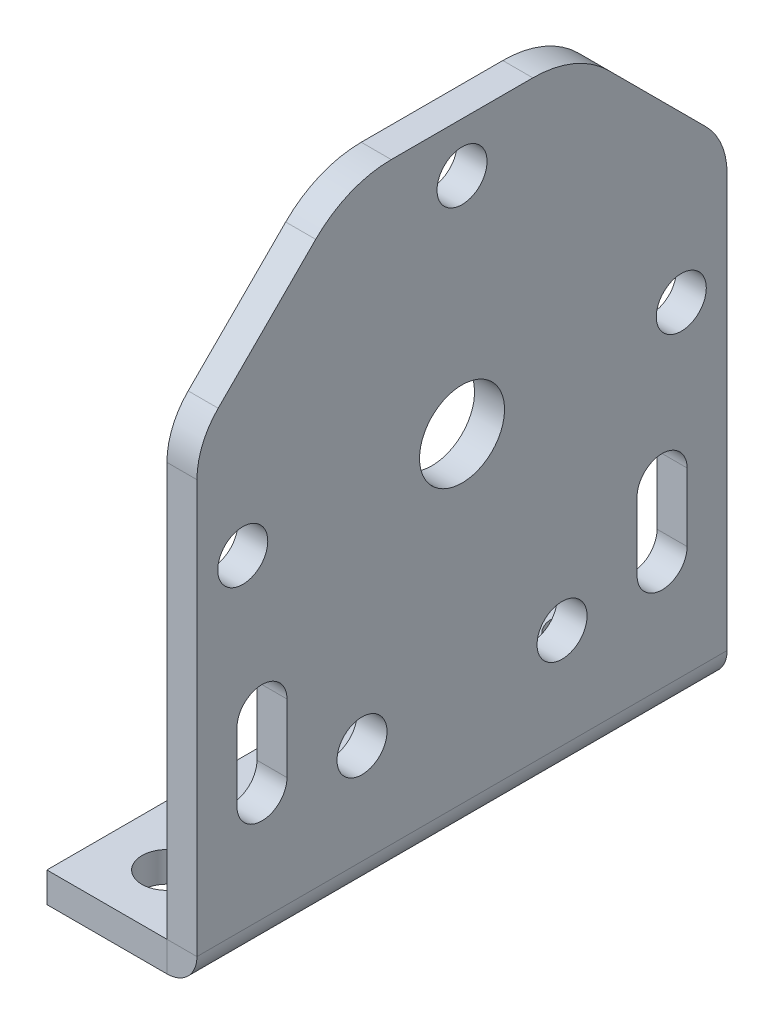
from build123d import *

# Parameters (mm, degrees)
SM_BASE_FLANGE_1_DEPTH = 53
HOLE_WIZARD_M6_1_D     = 5
HOLE_WIZARD_M6_1_DEPTH = 3
HOLE_WIZARD_M6_1_TIP   = 1.502151548
HOLE_WIZARD_M6_2_D     = 5
HOLE_WIZARD_M6_2_DEPTH = 17
HOLE_WIZARD_M6_2_TIP   = 1.502151548
SKETCH_16_R            = 4.25
CUT_EXTRUDE_1_DEPTH    = 3
CHAMFER_1_SIZE         = 15
FILLET_1_R             = 10.68
FILLET_2_R             = 7.25


# Read off the part's stored shape, not the designer's step: 基体-法兰1
with BuildPart() as part:
    # 基体-法兰1 outline → 基体-法兰1 (new body)
    with BuildSketch(Plane.XY):
        with BuildLine():
            Line((15, 0), (15, 59.29))
            Line((15, 59.29), (12, 59.29))
            Line((12, 59.29), (12, 0))
            Line((12, 0), (0, 0))
            Line((0, 0), (0, -3))
            Line((0, -3), (12, -3))
            ThreePointArc((12, -3), (14.121320344, -2.121320344), (15, 0))
        make_face()
    extrude(amount=SM_BASE_FLANGE_1_DEPTH)

    # M6 螺纹孔1
    with Locations(Plane(origin=(15, 0, 0), x_dir=(0, 0, -1), z_dir=(1, 0, 0))):
        with Locations((-26.5, 54.35), (-48.42, 32.43), (-4.58, 32.43), (-36.5, 10), (-16.5, 10)):
            Hole(HOLE_WIZARD_M6_1_D / 2, depth=HOLE_WIZARD_M6_1_DEPTH)
            with Locations((0, 0, -(HOLE_WIZARD_M6_1_DEPTH + HOLE_WIZARD_M6_1_TIP / 2))):  # 118° drill point
                Cone(0, HOLE_WIZARD_M6_1_D / 2, HOLE_WIZARD_M6_1_TIP, mode=Mode.SUBTRACT)

    # M6 螺纹孔2
    with Locations(Plane(origin=(0, 0, 0), x_dir=(1, 0, 0), z_dir=(0, 1, 0))):
        with Locations((6, -6), (6, -47)):
            Hole(HOLE_WIZARD_M6_2_D / 2, depth=HOLE_WIZARD_M6_2_DEPTH)
            with Locations((0, 0, -(HOLE_WIZARD_M6_2_DEPTH + HOLE_WIZARD_M6_2_TIP / 2))):  # 118° drill point
                Cone(0, HOLE_WIZARD_M6_2_D / 2, HOLE_WIZARD_M6_2_TIP, mode=Mode.SUBTRACT)

    # 草图16 → 切除-拉伸1 (cut)
    with BuildSketch(Plane.ZY.offset(-12)):
        with Locations((26.5, 32)):
            Circle(SKETCH_16_R)
        with BuildLine():
            Line((44, 17.8), (44, 11))
            ThreePointArc((44, 11), (46.5, 8.5), (49, 11))
            Line((49, 11), (49, 17.8))
            ThreePointArc((49, 17.8), (46.5, 20.3), (44, 17.8))
        make_face()
        with BuildLine():
            Line((9, 17.8), (9, 11))
            ThreePointArc((9, 11), (6.5, 8.5), (4, 11))
            Line((4, 11), (4, 17.8))
            ThreePointArc((4, 17.8), (6.5, 20.3), (9, 17.8))
        make_face()
    extrude(amount=-CUT_EXTRUDE_1_DEPTH, mode=Mode.SUBTRACT)

    # 倒角1
    chamfer_1_edges = [part.edges().sort_by_distance(p)[0] for p in [
        (13.5, 59.29, 0),
        (13.5, 59.29, 53),
    ]]
    chamfer(chamfer_1_edges, length=CHAMFER_1_SIZE)

    # 圆角1
    fillet_1_edges = [part.edges().sort_by_distance(p)[0] for p in [
        (13.5, 59.29, 15),
        (13.5, 59.29, 38),
    ]]
    fillet(fillet_1_edges, radius=FILLET_1_R)

    # 圆角2
    fillet_2_edges = [part.edges().sort_by_distance(p)[0] for p in [
        (13.5, 44.29, 53),
        (13.5, 44.29, 0),
    ]]
    fillet(fillet_2_edges, radius=FILLET_2_R)


solid = part.part
